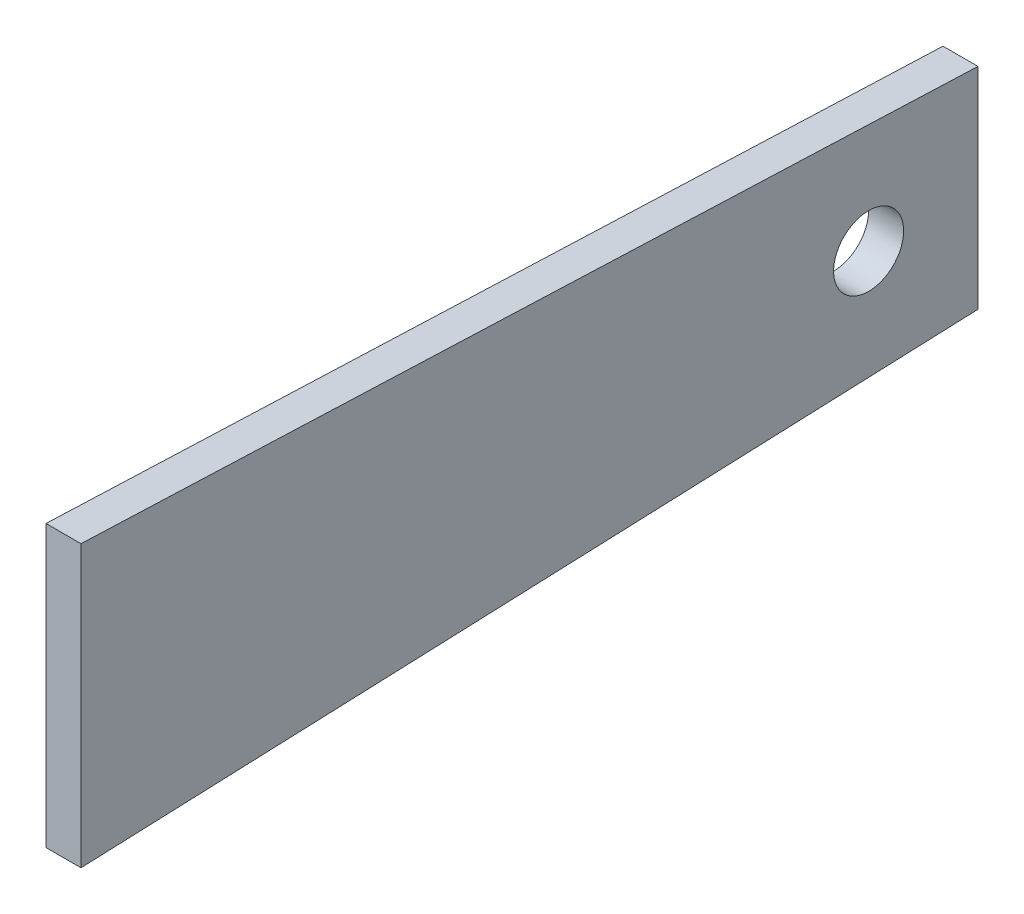
from build123d import *

# Parameters (mm, degrees)
SKETCH1_R           = 4
BOSS_EXTRUDE1_DEPTH = 4


with BuildPart() as part:
    # Sketch1 → Boss-Extrude1 (new body)
    with BuildSketch(Plane(origin=(0, 0, 0), x_dir=(0, 0, -1), z_dir=(1, 0, 0))):
        Polygon((-90, 16.039145957), (-90, -16.039145957), (12.5, -12.019395168), (12.5, 12.019395168), align=None)
        Circle(SKETCH1_R, mode=Mode.SUBTRACT)
    extrude(amount=BOSS_EXTRUDE1_DEPTH)


solid = part.part
